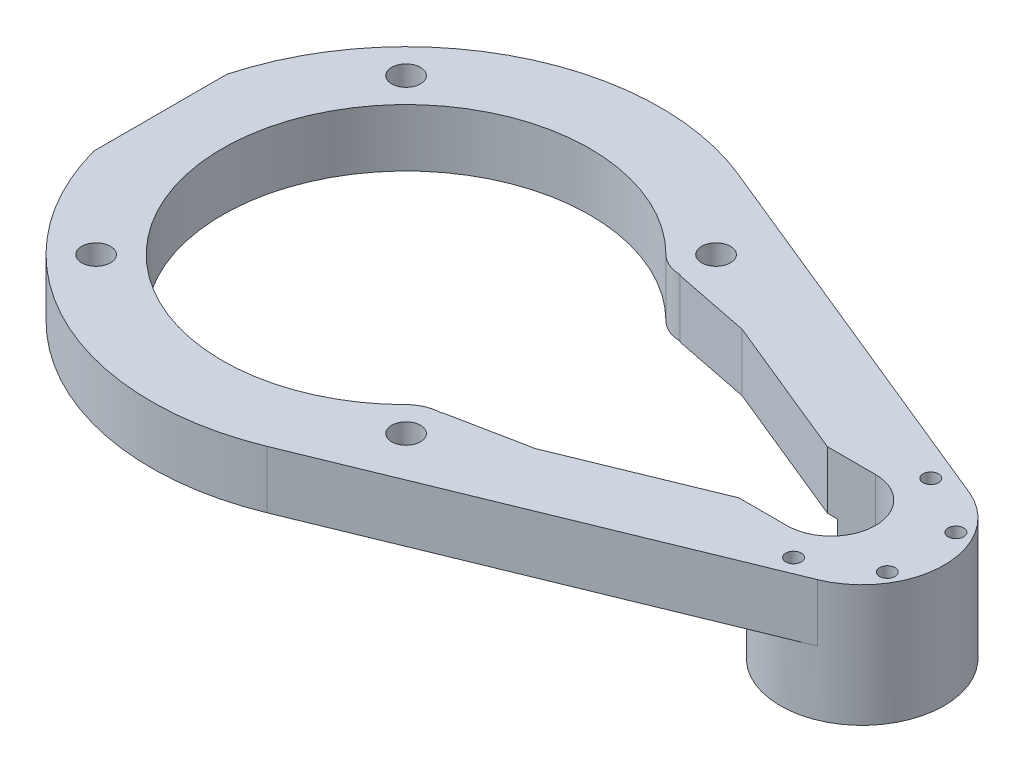
from build123d import *

# Parameters (mm, degrees)
SKETCH1_R           = 3.25
BOSS_EXTRUDE1_DEPTH = 13
BOSS_EXTRUDE2_START = -14.5
BOSS_EXTRUDE2_DEPTH = 14.5
CUT_EXTRUDE1_REACH  = 139.202
SKETCH3_R           = 1.75


with BuildPart() as part:
    # Sketch1 → Boss-Extrude1 (new body)
    with BuildSketch(Plane(origin=(0, 0, 0), x_dir=(1, 0, 0), z_dir=(0, 1, 0))):
        with BuildLine():
            ThreePointArc((21.76947877, 53.217002819), (-25.477840581, 51.544536415), (-55.5, 15.023634545))
            Line((-55.5, 15.023634545), (-55.5, -15.023634545))
            ThreePointArc((-55.5, -15.023634545), (-25.477840581, -51.544536415), (21.76947877, -53.217002819))
            Line((21.76947877, -53.217002819), (110.004400793, -17.122744217))
            ThreePointArc((110.004400793, -17.122744217), (121.5, 0), (110.004400793, 17.122744217))
            Line((110.004400793, 17.122744217), (21.76947877, 53.217002819))
        make_face()
        with Locations((-35, 35)):
            Circle(SKETCH1_R, mode=Mode.SUBTRACT)
        with BuildLine():
            ThreePointArc((29.343145829, 29.343145672), (31.938532593, 27.608963719), (35, 27))
            Line((35, 27), (35, 26.842197909))
            Line((35, 26.842197909), (52.547252782, 23.339790487))
            Line((52.547252782, 23.339790487), (85.157297123, 10))
            Line((85.157297123, 10), (96, 10))
            ThreePointArc((96, 10), (106, 0), (96, -10))
            Line((96, -10), (85.157297123, -10))
            Line((85.157297123, -10), (52.547252782, -23.339790487))
            Line((52.547252782, -23.339790487), (35, -26.842197909))
            Line((35, -26.842197909), (35, -27))
            ThreePointArc((35, -27), (31.938532454, -27.608963776), (29.343145617, -29.343145884))
            ThreePointArc((29.343145617, -29.343145884), (-41.497474683, 1.5e-07), (29.343145829, 29.343145672))
        make_face(mode=Mode.SUBTRACT)
        with Locations((35, 35)):
            Circle(SKETCH1_R, mode=Mode.SUBTRACT)
        with Locations((-35, -35)):
            Circle(SKETCH1_R, mode=Mode.SUBTRACT)
        with Locations((35, -35)):
            Circle(SKETCH1_R, mode=Mode.SUBTRACT)
    extrude(amount=BOSS_EXTRUDE1_DEPTH)

    # Sketch2 → Boss-Extrude2 (add)
    with BuildSketch(Plane(origin=(0, 0, 0), x_dir=(1, 0, 0), z_dir=(0, 1, 0)).offset(BOSS_EXTRUDE2_START)):
        with BuildLine():
            ThreePointArc((96, 10), (106, 0), (96, -10))
            Line((96, -10), (87.435617584, -10))
            ThreePointArc((87.435617584, -10), (108.210994401, -17.750930605), (121.5, 0))
            ThreePointArc((121.5, 0), (108.210994401, 17.750930605), (87.435617584, 10))
            Line((87.435617584, 10), (96, 10))
        make_face()
    extrude(amount=BOSS_EXTRUDE2_DEPTH)

    # Sketch3 → Cut-Extrude1 (cut, up to next)
    with BuildSketch(Plane.XZ.offset(14.5), mode=Mode.PRIVATE) as cut_extrude1_sk1:
        with Locations((103, 15.5)):
            Circle(SKETCH3_R)
    cut_extrude1_tool1 = extrude(cut_extrude1_sk1.sketch, amount=-CUT_EXTRUDE1_REACH, mode=Mode.PRIVATE) & part.part
    # Sketch3 → Cut-Extrude1 (cut, up to next)
    with BuildSketch(Plane.XZ.offset(14.5), mode=Mode.PRIVATE) as cut_extrude1_sk2:
        with Locations((116.423393759, 7.75)):
            Circle(SKETCH3_R)
    cut_extrude1_tool2 = extrude(cut_extrude1_sk2.sketch, amount=-CUT_EXTRUDE1_REACH, mode=Mode.PRIVATE) & part.part
    # Sketch3 → Cut-Extrude1 (cut, up to next)
    with BuildSketch(Plane.XZ.offset(14.5), mode=Mode.PRIVATE) as cut_extrude1_sk3:
        with Locations((116.423393759, -7.75)):
            Circle(SKETCH3_R)
    cut_extrude1_tool3 = extrude(cut_extrude1_sk3.sketch, amount=-CUT_EXTRUDE1_REACH, mode=Mode.PRIVATE) & part.part
    # Sketch3 → Cut-Extrude1 (cut, up to next)
    with BuildSketch(Plane.XZ.offset(14.5), mode=Mode.PRIVATE) as cut_extrude1_sk4:
        with Locations((103, -15.5)):
            Circle(SKETCH3_R)
    cut_extrude1_tool4 = extrude(cut_extrude1_sk4.sketch, amount=-CUT_EXTRUDE1_REACH, mode=Mode.PRIVATE) & part.part
    add(cut_extrude1_tool1.solids().sort_by_distance((103, -14.5, 15.5))[0], mode=Mode.SUBTRACT)
    add(cut_extrude1_tool2.solids().sort_by_distance((116.423394, -14.5, 7.75))[0], mode=Mode.SUBTRACT)
    add(cut_extrude1_tool3.solids().sort_by_distance((116.423394, -14.5, -7.75))[0], mode=Mode.SUBTRACT)
    add(cut_extrude1_tool4.solids().sort_by_distance((103, -14.5, -15.5))[0], mode=Mode.SUBTRACT)


solid = part.part
